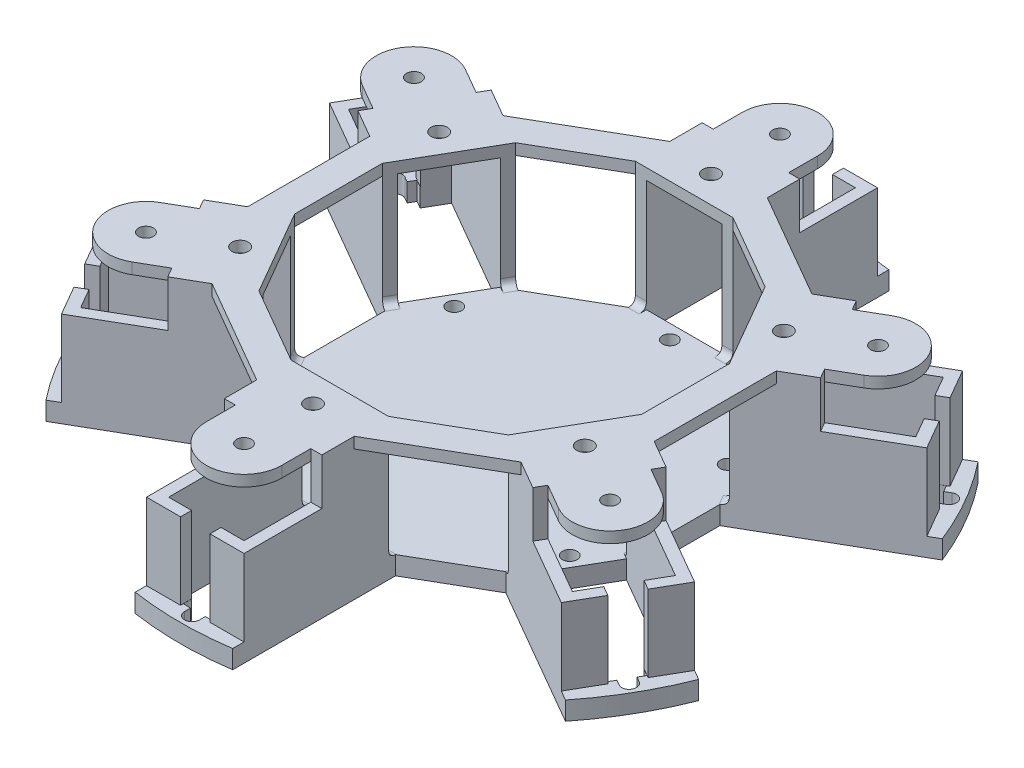
from build123d import *

# Parameters (mm, degrees)
SKETCH1_R           = 57.15
SKETCH1_R_2         = 1.27
BOSS_EXTRUDE2_DEPTH = 3.175
CUT_EXTRUDE1_REACH  = 82.885
BOSS_EXTRUDE3_DEPTH = 13.208
SKETCH4_W           = 5.08
SKETCH4_H           = 13.208
CUT_EXTRUDE2_DEPTH  = 13.208
CIRPATTERN2_COUNT   = 6
FILLET1_SIZE        = 1.27
SKETCH5_W           = 1.905
SKETCH5_H           = 11.5
BOSS_EXTRUDE4_DEPTH = 6.096
BOSS_EXTRUDE5_DEPTH = 1.905
CUT_EXTRUDE3_REACH  = 83.771
SKETCH7_R           = 1.27
CUT_EXTRUDE6_REACH  = 83.771
SKETCH10_R          = 1.397


with BuildPart() as part:
    # Sketch1 → Boss-Extrude2 (new body)
    with BuildSketch(Plane(origin=(0, 0, 0), x_dir=(1, 0, 0), z_dir=(0, 1, 0))):
        with Locations(Location((0, 0, 0), (0, 0, 270))):
            Circle(SKETCH1_R)
        with Locations(Location((0, 27.199984322, 0), (0, 0, 270))):
            Circle(SKETCH1_R_2, mode=Mode.SUBTRACT)
        with Locations(Location((23.555877406, 13.599992161, 0), (0, 0, 270))):
            Circle(SKETCH1_R_2, mode=Mode.SUBTRACT)
        with Locations(Location((23.555877406, -13.599992161, 0), (0, 0, 270))):
            Circle(SKETCH1_R_2, mode=Mode.SUBTRACT)
        with Locations(Location((0, -27.199984322, 0), (0, 0, 270))):
            Circle(SKETCH1_R_2, mode=Mode.SUBTRACT)
        with Locations(Location((-23.555877406, -13.599992161, 0), (0, 0, 270))):
            Circle(SKETCH1_R_2, mode=Mode.SUBTRACT)
        with Locations(Location((-23.555877406, 13.599992161, 0), (0, 0, 270))):
            Circle(SKETCH1_R_2, mode=Mode.SUBTRACT)
        with BuildLine():
            Line((42.36354444, 31.964157286), (22.444960153, 20.464157286))
            Line((22.444960153, 20.464157286), (28.944960153, 9.205827036))
            Line((28.944960153, 9.205827036), (48.86354444, 20.705827036))
            Line((48.86354444, 20.705827036), (46.873897128, 24.151997269))
            Line((46.873897128, 24.151997269), (48.124235564, 24.873880501))
            Line((48.124235564, 24.873880501), (47.498882875, 25.957023131))
            Line((47.498882875, 25.957023131), (48.387627187, 26.470139898))
            ThreePointArc((48.387627187, 26.470139898), (48.85247945, 28.204992161), (47.117627187, 28.669844424))
            Line((47.117627187, 28.669844424), (46.228882875, 28.156727656))
            Line((46.228882875, 28.156727656), (45.603530187, 29.239870285))
            Line((45.603530187, 29.239870285), (44.353191751, 28.517987053))
            Line((44.353191751, 28.517987053), (42.36354444, 31.964157286))
        make_face(mode=Mode.SUBTRACT)
        with BuildLine():
            Line((-6.5, 52.669984322), (-2.520705377, 52.669984322))
            Line((-2.520705377, 52.669984322), (-2.520705377, 54.113750787))
            Line((-2.520705377, 54.113750787), (-1.27, 54.113750787))
            Line((-1.27, 54.113750787), (-1.27, 55.139984322))
            ThreePointArc((-1.27, 55.139984322), (0, 56.409984322), (1.27, 55.139984322))
            Line((1.27, 55.139984322), (1.27, 54.113750787))
            Line((1.27, 54.113750787), (2.520705377, 54.113750787))
            Line((2.520705377, 54.113750787), (2.520705377, 52.669984322))
            Line((2.520705377, 52.669984322), (6.5, 52.669984322))
            Line((6.5, 52.669984322), (6.5, 29.669984322))
            Line((6.5, 29.669984322), (-6.5, 29.669984322))
            Line((-6.5, 29.669984322), (-6.5, 52.669984322))
        make_face(mode=Mode.SUBTRACT)
        with BuildLine():
            Line((48.86354444, -20.705827036), (28.944960153, -9.205827036))
            Line((28.944960153, -9.205827036), (22.444960153, -20.464157286))
            Line((22.444960153, -20.464157286), (42.36354444, -31.964157286))
            Line((42.36354444, -31.964157286), (44.353191751, -28.517987053))
            Line((44.353191751, -28.517987053), (45.603530187, -29.239870285))
            Line((45.603530187, -29.239870285), (46.228882876, -28.156727656))
            Line((46.228882876, -28.156727656), (47.117627187, -28.669844424))
            ThreePointArc((47.117627187, -28.669844424), (48.85247945, -28.204992161), (48.387627187, -26.470139898))
            Line((48.387627187, -26.470139898), (47.498882876, -25.957023131))
            Line((47.498882876, -25.957023131), (48.124235564, -24.873880501))
            Line((48.124235564, -24.873880501), (46.873897128, -24.151997269))
            Line((46.873897128, -24.151997269), (48.86354444, -20.705827036))
        make_face(mode=Mode.SUBTRACT)
        with BuildLine():
            Line((6.5, -52.669984322), (6.5, -29.669984322))
            Line((6.5, -29.669984322), (-6.5, -29.669984322))
            Line((-6.5, -29.669984322), (-6.5, -52.669984322))
            Line((-6.5, -52.669984322), (-2.520705377, -52.669984322))
            Line((-2.520705377, -52.669984322), (-2.520705377, -54.113750787))
            Line((-2.520705377, -54.113750787), (-1.27, -54.113750787))
            Line((-1.27, -54.113750787), (-1.27, -55.139984322))
            ThreePointArc((-1.27, -55.139984322), (0, -56.409984322), (1.27, -55.139984322))
            Line((1.27, -55.139984322), (1.27, -54.113750787))
            Line((1.27, -54.113750787), (2.520705377, -54.113750787))
            Line((2.520705377, -54.113750787), (2.520705377, -52.669984322))
            Line((2.520705377, -52.669984322), (6.5, -52.669984322))
        make_face(mode=Mode.SUBTRACT)
        with BuildLine():
            Line((-42.36354444, -31.964157286), (-22.444960153, -20.464157286))
            Line((-22.444960153, -20.464157286), (-28.944960153, -9.205827036))
            Line((-28.944960153, -9.205827036), (-48.86354444, -20.705827036))
            Line((-48.86354444, -20.705827036), (-46.873897128, -24.151997269))
            Line((-46.873897128, -24.151997269), (-48.124235564, -24.873880501))
            Line((-48.124235564, -24.873880501), (-47.498882875, -25.957023131))
            Line((-47.498882875, -25.957023131), (-48.387627187, -26.470139898))
            ThreePointArc((-48.387627187, -26.470139898), (-48.85247945, -28.204992161), (-47.117627187, -28.669844424))
            Line((-47.117627187, -28.669844424), (-46.228882875, -28.156727656))
            Line((-46.228882875, -28.156727656), (-45.603530187, -29.239870285))
            Line((-45.603530187, -29.239870285), (-44.353191751, -28.517987053))
            Line((-44.353191751, -28.517987053), (-42.36354444, -31.964157286))
        make_face(mode=Mode.SUBTRACT)
        with BuildLine():
            Line((-48.86354444, 20.705827036), (-28.944960153, 9.205827036))
            Line((-28.944960153, 9.205827036), (-22.444960153, 20.464157286))
            Line((-22.444960153, 20.464157286), (-42.36354444, 31.964157286))
            Line((-42.36354444, 31.964157286), (-44.353191751, 28.517987053))
            Line((-44.353191751, 28.517987053), (-45.603530187, 29.239870285))
            Line((-45.603530187, 29.239870285), (-46.228882875, 28.156727656))
            Line((-46.228882875, 28.156727656), (-47.117627187, 28.669844424))
            ThreePointArc((-47.117627187, 28.669844424), (-48.85247945, 28.204992161), (-48.387627187, 26.470139898))
            Line((-48.387627187, 26.470139898), (-47.498882875, 25.957023131))
            Line((-47.498882875, 25.957023131), (-48.124235564, 24.873880501))
            Line((-48.124235564, 24.873880501), (-46.873897128, 24.151997269))
            Line((-46.873897128, 24.151997269), (-48.86354444, 20.705827036))
        make_face(mode=Mode.SUBTRACT)
    extrude(amount=BOSS_EXTRUDE2_DEPTH)

    # Sketch2 → Cut-Extrude1 (cut, up to next)
    with BuildSketch(Plane(origin=(0, 3.175, 0), x_dir=(1, 0, 0), z_dir=(0, 1, 0)), mode=Mode.PRIVATE) as cut_extrude1_sk1:
        with BuildLine():
            Line((-8.405, 28.480431649), (-20.462277319, 21.519159343))
            Line((-20.462277319, 21.519159343), (-44.752671905, 35.543225196))
            ThreePointArc((-44.752671905, 35.543225196), (-28.575, 49.493351826), (-8.405, 56.528563355))
            Line((-8.405, 56.528563355), (-8.405, 28.480431649))
        make_face()
    cut_extrude1_tool1 = extrude(cut_extrude1_sk1.sketch, amount=-CUT_EXTRUDE1_REACH, mode=Mode.PRIVATE) & part.part
    # Sketch2 → Cut-Extrude1 (cut, up to next)
    with BuildSketch(Plane(origin=(0, 3.175, 0), x_dir=(1, 0, 0), z_dir=(0, 1, 0)), mode=Mode.PRIVATE) as cut_extrude1_sk2:
        with BuildLine():
            Line((8.405, 28.480431649), (8.405, 56.528563355))
            ThreePointArc((8.405, 56.528563355), (28.575, 49.493351826), (44.752671905, 35.543225196))
            Line((44.752671905, 35.543225196), (20.462277319, 21.519159344))
            Line((20.462277319, 21.519159344), (8.405, 28.480431649))
        make_face()
    cut_extrude1_tool2 = extrude(cut_extrude1_sk2.sketch, amount=-CUT_EXTRUDE1_REACH, mode=Mode.PRIVATE) & part.part
    # Sketch2 → Cut-Extrude1 (cut, up to next)
    with BuildSketch(Plane(origin=(0, 3.175, 0), x_dir=(1, 0, 0), z_dir=(0, 1, 0)), mode=Mode.PRIVATE) as cut_extrude1_sk3:
        with BuildLine():
            Line((28.867277319, 6.961272306), (53.157671905, 20.985338159))
            ThreePointArc((53.157671905, 20.985338159), (57.15, 0), (53.157671905, -20.985338159))
            Line((53.157671905, -20.985338159), (28.867277319, -6.961272306))
            Line((28.867277319, -6.961272306), (28.867277319, 6.961272306))
        make_face()
    cut_extrude1_tool3 = extrude(cut_extrude1_sk3.sketch, amount=-CUT_EXTRUDE1_REACH, mode=Mode.PRIVATE) & part.part
    # Sketch2 → Cut-Extrude1 (cut, up to next)
    with BuildSketch(Plane(origin=(0, 3.175, 0), x_dir=(1, 0, 0), z_dir=(0, 1, 0)), mode=Mode.PRIVATE) as cut_extrude1_sk4:
        with BuildLine():
            Line((20.462277319, -21.519159343), (44.752671905, -35.543225196))
            ThreePointArc((44.752671905, -35.543225196), (28.575, -49.493351826), (8.405, -56.528563355))
            Line((8.405, -56.528563355), (8.405, -28.480431649))
            Line((8.405, -28.480431649), (20.462277319, -21.519159343))
        make_face()
    cut_extrude1_tool4 = extrude(cut_extrude1_sk4.sketch, amount=-CUT_EXTRUDE1_REACH, mode=Mode.PRIVATE) & part.part
    # Sketch2 → Cut-Extrude1 (cut, up to next)
    with BuildSketch(Plane(origin=(0, 3.175, 0), x_dir=(1, 0, 0), z_dir=(0, 1, 0)), mode=Mode.PRIVATE) as cut_extrude1_sk5:
        with BuildLine():
            Line((-8.405, -28.480431649), (-8.405, -56.528563355))
            ThreePointArc((-8.405, -56.528563355), (-28.575, -49.493351826), (-44.752671905, -35.543225196))
            Line((-44.752671905, -35.543225196), (-20.462277319, -21.519159344))
            Line((-20.462277319, -21.519159344), (-8.405, -28.480431649))
        make_face()
    cut_extrude1_tool5 = extrude(cut_extrude1_sk5.sketch, amount=-CUT_EXTRUDE1_REACH, mode=Mode.PRIVATE) & part.part
    # Sketch2 → Cut-Extrude1 (cut, up to next)
    with BuildSketch(Plane(origin=(0, 3.175, 0), x_dir=(1, 0, 0), z_dir=(0, 1, 0)), mode=Mode.PRIVATE) as cut_extrude1_sk6:
        with BuildLine():
            Line((-28.867277319, -6.961272306), (-53.157671905, -20.985338159))
            ThreePointArc((-53.157671905, -20.985338159), (-57.15, 0), (-53.157671905, 20.985338159))
            Line((-53.157671905, 20.985338159), (-28.867277319, 6.961272306))
            Line((-28.867277319, 6.961272306), (-28.867277319, -6.961272306))
        make_face()
    cut_extrude1_tool6 = extrude(cut_extrude1_sk6.sketch, amount=-CUT_EXTRUDE1_REACH, mode=Mode.PRIVATE) & part.part
    add(cut_extrude1_tool1.solids().sort_by_distance((-22.354851, 3.175, -38.719738))[0], mode=Mode.SUBTRACT)
    add(cut_extrude1_tool2.solids().sort_by_distance((22.354851, 3.175, -38.719738))[0], mode=Mode.SUBTRACT)
    add(cut_extrude1_tool3.solids().sort_by_distance((44.709702, 3.175, 0))[0], mode=Mode.SUBTRACT)
    add(cut_extrude1_tool4.solids().sort_by_distance((22.354851, 3.175, 38.719738))[0], mode=Mode.SUBTRACT)
    add(cut_extrude1_tool5.solids().sort_by_distance((-22.354851, 3.175, 38.719738))[0], mode=Mode.SUBTRACT)
    add(cut_extrude1_tool6.solids().sort_by_distance((-44.709702, 3.175, 0))[0], mode=Mode.SUBTRACT)

    # Sketch3 → Boss-Extrude3 (add)
    with BuildSketch(Plane(origin=(0, 3.175, 0), x_dir=(1, 0, 0), z_dir=(0, 1, 0))):
        Polygon((42.36354444, 31.964157286), (22.444960153, 20.464157286), (21.492460153, 22.11393568), (41.41104444, 33.61393568), (43.060822834, 34.56643568), (51.465822834, 20.008548642), (49.81604444, 19.056048642), (29.897460153, 7.556048642), (28.944960153, 9.205827036), (48.86354444, 20.705827036), align=None)
        Polygon((-6.5, 52.669984322), (-6.5, 29.669984322), (-8.405, 29.669984322), (-8.405, 52.669984322), (-8.405, 54.574984322), (8.405, 54.574984322), (8.405, 52.669984322), (8.405, 29.669984322), (6.5, 29.669984322), (6.5, 52.669984322), align=None)
        Polygon((48.86354444, -20.705827036), (28.944960153, -9.205827036), (29.897460153, -7.556048642), (49.81604444, -19.056048642), (51.465822834, -20.008548642), (43.060822834, -34.56643568), (41.41104444, -33.61393568), (21.492460153, -22.11393568), (22.444960153, -20.464157286), (42.36354444, -31.964157286), align=None)
        Polygon((6.5, -52.669984322), (6.5, -29.669984322), (8.405, -29.669984322), (8.405, -52.669984322), (8.405, -54.574984322), (-8.405, -54.574984322), (-8.405, -52.669984322), (-8.405, -29.669984322), (-6.5, -29.669984322), (-6.5, -52.669984322), align=None)
        Polygon((-42.36354444, -31.964157286), (-22.444960153, -20.464157286), (-21.492460153, -22.11393568), (-41.41104444, -33.61393568), (-43.060822834, -34.56643568), (-51.465822834, -20.008548642), (-49.81604444, -19.056048642), (-29.897460153, -7.556048642), (-28.944960153, -9.205827036), (-48.86354444, -20.705827036), align=None)
        Polygon((-48.86354444, 20.705827036), (-28.944960153, 9.205827036), (-29.897460153, 7.556048642), (-49.81604444, 19.056048642), (-51.465822834, 20.008548642), (-43.060822834, 34.56643568), (-41.41104444, 33.61393568), (-21.492460153, 22.11393568), (-22.444960153, 20.464157286), (-42.36354444, 31.964157286), align=None)
    extrude(amount=BOSS_EXTRUDE3_DEPTH)

    # Sketch4 → Cut-Extrude2 (cut)
    with BuildSketch(Plane(origin=(0, 0, -54.574984322), x_dir=(-1, 0, 0), z_dir=(0, 0, -1))):
        with Locations((0, 9.779)):
            Rectangle(SKETCH4_W, SKETCH4_H)
    cut_extrude2 = extrude(amount=-CUT_EXTRUDE2_DEPTH, mode=Mode.SUBTRACT)

    # CirPattern2: Cut-Extrude2 ×6 about axis
    cirpattern2_axis = Axis((0, 0, 0), (0, 1, 0))
    for i in range(1, CIRPATTERN2_COUNT):
        add(cut_extrude2.rotate(cirpattern2_axis, i * 360 / CIRPATTERN2_COUNT), mode=Mode.SUBTRACT)

    # Fillet1
    # a fillet whose section is not a circle: 1.27 mm, written as the material it adds along each edge
    with BuildSketch(Plane(origin=(22.444960153, 3.175, -20.464157286), x_dir=(-0.8660254037844386, 0, 0.5000000000000001), z_dir=(-0.5000000000000001, 0, -0.8660254037844387))) as fillet1_piece_1_section:
        with BuildLine():
            Bezier((FILLET1_SIZE, 0), (0, 0), (0, FILLET1_SIZE), weights=[1, 1, 1])
            Line((0, FILLET1_SIZE), (0, 0))
            Line((0, 0), (FILLET1_SIZE, 0))
        make_face()
    fillet1_piece_1 = extrude(amount=5.08, mode=Mode.PRIVATE)
    fillet1_piece_1 = split(fillet1_piece_1, bisect_by=Plane(origin=(22.406118736, 3.175, -20.396881978), z_dir=(-0.4999999999995493, 0, 0.8660254037846988)), keep=Keep.TOP, mode=Mode.PRIVATE)
    add(fillet1_piece_1)
    with BuildSketch(Plane(origin=(22.444960153, 3.175, -20.464157286), x_dir=(-0.8660254037844386, 0, 0.5000000000000001), z_dir=(-0.5000000000000001, 0, -0.8660254037844387)), Plane(origin=(29.897460153, 3.175, -7.556048642), x_dir=(-0.866025403784437, 0, 0.5000000000000027), z_dir=(-0.5000000000000028, 0, -0.8660254037844372)), Plane(origin=(28.944960153, 3.175, 9.205827036), x_dir=(-0.8660254037844377, 0, -0.5000000000000017), z_dir=(0.5000000000000017, 0, -0.8660254037844377)), Plane(origin=(21.492460153, 3.175, 22.11393568), x_dir=(-0.8660254037844394, 0, -0.49999999999999867), z_dir=(0.4999999999999987, 0, -0.8660254037844395)), Plane(origin=(-22.444960153, 3.175, 20.464157286), x_dir=(0.8660254037844394, 0, -0.49999999999999867), z_dir=(0.4999999999999987, 0, 0.8660254037844395)), Plane(origin=(-29.897460153, 3.175, 7.556048642), x_dir=(0.8660254037844372, 0, -0.5000000000000024), z_dir=(0.5000000000000026, 0, 0.8660254037844373)), Plane(origin=(-28.944960153, 3.175, -9.205827036), x_dir=(0.8660254037844395, 0, 0.49999999999999845), z_dir=(-0.4999999999999985, 0, 0.8660254037844395)), Plane(origin=(-21.492460153, 3.175, -22.11393568), x_dir=(0.8660254037844394, 0, 0.49999999999999867), z_dir=(-0.4999999999999987, 0, 0.8660254037844395)), Plane(origin=(-6.5, 3.175, -29.669984322), x_dir=(0, 0, 1), z_dir=(-1, 0, 0)), Plane(origin=(8.405, 3.175, -29.669984322), x_dir=(0, 0, 1), z_dir=(-1, 0, 0))) as fillet1_piece_2:
        with BuildLine():
            Bezier((FILLET1_SIZE, 0), (0, 0), (0, FILLET1_SIZE), weights=[1, 1, 1])
            Line((0, FILLET1_SIZE), (0, 0))
            Line((0, 0), (FILLET1_SIZE, 0))
        make_face()
    extrude(amount=1.905)
    with BuildSketch(Plane(origin=(31.484960153, 3.175, -4.806417985), x_dir=(-0.866025403784437, 0, 0.5000000000000027), z_dir=(-0.5000000000000028, 0, -0.8660254037844372))) as fillet1_piece_3_section:
        with BuildLine():
            Bezier((FILLET1_SIZE, 0), (0, 0), (0, FILLET1_SIZE), weights=[1, 1, 1])
            Line((0, FILLET1_SIZE), (0, 0))
            Line((0, 0), (FILLET1_SIZE, 0))
        make_face()
    fillet1_piece_3 = extrude(amount=5.08, mode=Mode.PRIVATE)
    fillet1_piece_3 = split(fillet1_piece_3, bisect_by=Plane(origin=(28.867277319, 3.175, -4.806417985), z_dir=(-1, 0, 0)), keep=Keep.TOP, mode=Mode.PRIVATE)
    add(fillet1_piece_3)
    with BuildSketch(Plane(origin=(28.944960153, 3.175, 9.205827036), x_dir=(-0.8660254037844377, 0, -0.5000000000000017), z_dir=(0.5000000000000017, 0, -0.8660254037844377))) as fillet1_piece_4_section:
        with BuildLine():
            Bezier((FILLET1_SIZE, 0), (0, 0), (0, FILLET1_SIZE), weights=[1, 1, 1])
            Line((0, FILLET1_SIZE), (0, 0))
            Line((0, 0), (FILLET1_SIZE, 0))
        make_face()
    fillet1_piece_4 = extrude(amount=5.08, mode=Mode.PRIVATE)
    fillet1_piece_4 = split(fillet1_piece_4, bisect_by=Plane(origin=(28.867277319, 3.175, 9.205827036), z_dir=(-1, 0, 0)), keep=Keep.TOP, mode=Mode.PRIVATE)
    add(fillet1_piece_4)
    with BuildSketch(Plane(origin=(19.904960153, 3.175, 24.863566337), x_dir=(-0.8660254037844394, 0, -0.49999999999999867), z_dir=(0.4999999999999987, 0, -0.8660254037844395))) as fillet1_piece_5_section:
        with BuildLine():
            Bezier((FILLET1_SIZE, 0), (0, 0), (0, FILLET1_SIZE), weights=[1, 1, 1])
            Line((0, FILLET1_SIZE), (0, 0))
            Line((0, 0), (FILLET1_SIZE, 0))
        make_face()
    fillet1_piece_5 = extrude(amount=5.08, mode=Mode.PRIVATE)
    fillet1_piece_5 = split(fillet1_piece_5, bisect_by=Plane(origin=(18.596118736, 3.175, 22.596586504), z_dir=(-0.5000000000004493, 0, -0.8660254037841792)), keep=Keep.TOP, mode=Mode.PRIVATE)
    add(fillet1_piece_5)
    with BuildSketch(Plane(origin=(6.5, 3.175, 29.669984322), x_dir=(0, 1, 0), z_dir=(1, 0, 0))) as fillet1_piece_6_section:
        with BuildLine():
            Bezier((FILLET1_SIZE, 0), (0, 0), (0, -FILLET1_SIZE), weights=[1, 1, 1])
            Line((0, -FILLET1_SIZE), (0, 0))
            Line((0, 0), (FILLET1_SIZE, 0))
        make_face()
    fillet1_piece_6 = extrude(amount=5.08, mode=Mode.PRIVATE)
    fillet1_piece_6 = split(fillet1_piece_6, bisect_by=Plane(origin=(6.461158583, 3.175, 29.602709015), z_dir=(-0.5000000000004493, 0, -0.8660254037841792)), keep=Keep.TOP, mode=Mode.PRIVATE)
    add(fillet1_piece_6)
    with BuildSketch(Plane(origin=(6.5, 3.175, 29.669984322), x_dir=(0, 1, 0), z_dir=(1, 0, 0)), Plane(origin=(-8.405, 3.175, 29.669984322), x_dir=(0, 1, 0), z_dir=(1, 0, 0))) as fillet1_piece_7:
        with BuildLine():
            Bezier((FILLET1_SIZE, 0), (0, 0), (0, -FILLET1_SIZE), weights=[1, 1, 1])
            Line((0, -FILLET1_SIZE), (0, 0))
            Line((0, 0), (FILLET1_SIZE, 0))
        make_face()
    extrude(amount=1.905)
    with BuildSketch(Plane(origin=(-11.58, 3.175, 29.669984322), x_dir=(0, 1, 0), z_dir=(1, 0, 0))) as fillet1_piece_8_section:
        with BuildLine():
            Bezier((FILLET1_SIZE, 0), (0, 0), (0, -FILLET1_SIZE), weights=[1, 1, 1])
            Line((0, -FILLET1_SIZE), (0, 0))
            Line((0, 0), (FILLET1_SIZE, 0))
        make_face()
    fillet1_piece_8 = extrude(amount=5.08, mode=Mode.PRIVATE)
    fillet1_piece_8 = split(fillet1_piece_8, bisect_by=Plane(origin=(-10.271158583, 3.175, 27.403004489), z_dir=(0.4999999999995525, 0, -0.866025403784697)), keep=Keep.TOP, mode=Mode.PRIVATE)
    add(fillet1_piece_8)
    with BuildSketch(Plane(origin=(-22.444960153, 3.175, 20.464157286), x_dir=(0.8660254037844394, 0, -0.49999999999999867), z_dir=(0.4999999999999987, 0, 0.8660254037844395))) as fillet1_piece_9_section:
        with BuildLine():
            Bezier((FILLET1_SIZE, 0), (0, 0), (0, FILLET1_SIZE), weights=[1, 1, 1])
            Line((0, FILLET1_SIZE), (0, 0))
            Line((0, 0), (FILLET1_SIZE, 0))
        make_face()
    fillet1_piece_9 = extrude(amount=5.08, mode=Mode.PRIVATE)
    fillet1_piece_9 = split(fillet1_piece_9, bisect_by=Plane(origin=(-22.406118736, 3.175, 20.396881978), z_dir=(0.4999999999995525, 0, -0.866025403784697)), keep=Keep.TOP, mode=Mode.PRIVATE)
    add(fillet1_piece_9)
    with BuildSketch(Plane(origin=(-31.484960153, 3.175, 4.806417985), x_dir=(0.8660254037844372, 0, -0.5000000000000024), z_dir=(0.5000000000000026, 0, 0.8660254037844373))) as fillet1_piece_10_section:
        with BuildLine():
            Bezier((FILLET1_SIZE, 0), (0, 0), (0, FILLET1_SIZE), weights=[1, 1, 1])
            Line((0, FILLET1_SIZE), (0, 0))
            Line((0, 0), (FILLET1_SIZE, 0))
        make_face()
    fillet1_piece_10 = extrude(amount=5.08, mode=Mode.PRIVATE)
    fillet1_piece_10 = split(fillet1_piece_10, bisect_by=Plane(origin=(-28.867277319, 3.175, 4.806417985), z_dir=(1, 0, 0)), keep=Keep.TOP, mode=Mode.PRIVATE)
    add(fillet1_piece_10)
    with BuildSketch(Plane(origin=(-28.944960153, 3.175, -9.205827036), x_dir=(0.8660254037844395, 0, 0.49999999999999845), z_dir=(-0.4999999999999985, 0, 0.8660254037844395))) as fillet1_piece_11_section:
        with BuildLine():
            Bezier((FILLET1_SIZE, 0), (0, 0), (0, FILLET1_SIZE), weights=[1, 1, 1])
            Line((0, FILLET1_SIZE), (0, 0))
            Line((0, 0), (FILLET1_SIZE, 0))
        make_face()
    fillet1_piece_11 = extrude(amount=5.08, mode=Mode.PRIVATE)
    fillet1_piece_11 = split(fillet1_piece_11, bisect_by=Plane(origin=(-28.867277319, 3.175, -9.205827036), z_dir=(1, 0, 0)), keep=Keep.TOP, mode=Mode.PRIVATE)
    add(fillet1_piece_11)
    with BuildSketch(Plane(origin=(-19.904960153, 3.175, -24.863566337), x_dir=(0.8660254037844394, 0, 0.49999999999999867), z_dir=(-0.4999999999999987, 0, 0.8660254037844395))) as fillet1_piece_12_section:
        with BuildLine():
            Bezier((FILLET1_SIZE, 0), (0, 0), (0, FILLET1_SIZE), weights=[1, 1, 1])
            Line((0, FILLET1_SIZE), (0, 0))
            Line((0, 0), (FILLET1_SIZE, 0))
        make_face()
    fillet1_piece_12 = extrude(amount=5.08, mode=Mode.PRIVATE)
    fillet1_piece_12 = split(fillet1_piece_12, bisect_by=Plane(origin=(-18.596118736, 3.175, -22.596586504), z_dir=(0.5000000000004517, 0, 0.8660254037841778)), keep=Keep.TOP, mode=Mode.PRIVATE)
    add(fillet1_piece_12)
    with BuildSketch(Plane(origin=(-6.5, 3.175, -29.669984322), x_dir=(0, 0, 1), z_dir=(-1, 0, 0))) as fillet1_piece_13_section:
        with BuildLine():
            Bezier((FILLET1_SIZE, 0), (0, 0), (0, FILLET1_SIZE), weights=[1, 1, 1])
            Line((0, FILLET1_SIZE), (0, 0))
            Line((0, 0), (FILLET1_SIZE, 0))
        make_face()
    fillet1_piece_13 = extrude(amount=5.08, mode=Mode.PRIVATE)
    fillet1_piece_13 = split(fillet1_piece_13, bisect_by=Plane(origin=(-6.461158583, 3.175, -29.602709015), z_dir=(0.5000000000004517, 0, 0.8660254037841778)), keep=Keep.TOP, mode=Mode.PRIVATE)
    add(fillet1_piece_13)
    with BuildSketch(Plane(origin=(11.58, 3.175, -29.669984322), x_dir=(0, 0, 1), z_dir=(-1, 0, 0))) as fillet1_piece_14_section:
        with BuildLine():
            Bezier((FILLET1_SIZE, 0), (0, 0), (0, FILLET1_SIZE), weights=[1, 1, 1])
            Line((0, FILLET1_SIZE), (0, 0))
            Line((0, 0), (FILLET1_SIZE, 0))
        make_face()
    fillet1_piece_14 = extrude(amount=5.08, mode=Mode.PRIVATE)
    fillet1_piece_14 = split(fillet1_piece_14, bisect_by=Plane(origin=(10.271158583, 3.175, -27.403004489), z_dir=(-0.4999999999995493, 0, 0.8660254037846988)), keep=Keep.TOP, mode=Mode.PRIVATE)
    add(fillet1_piece_14)

    # Sketch5 → Boss-Extrude4 (add)
    with BuildSketch(Plane(origin=(0, 16.383, 0), x_dir=(1, 0, 0), z_dir=(0, 1, 0))):
        with Locations((-7.4525, 35.419984322)):
            Rectangle(SKETCH5_W, SKETCH5_H)
        with Locations((7.4525, 35.419984322)):
            Rectangle(SKETCH5_W, SKETCH5_H)
        Polygon((32.404252296, 26.214157286), (22.444960153, 20.464157286), (21.492460153, 22.11393568), (31.451752296, 27.86393568), align=None)
        Polygon((28.944960153, 9.205827036), (29.897460153, 7.556048642), (39.856752296, 13.306048642), (38.904252296, 14.955827036), align=None)
        Polygon((38.904252296, -14.955827036), (28.944960153, -9.205827036), (29.897460153, -7.556048642), (39.856752296, -13.306048642), align=None)
        Polygon((22.444960153, -20.464157286), (21.492460153, -22.11393568), (31.451752296, -27.86393568), (32.404252296, -26.214157286), align=None)
        with Locations((7.4525, -35.419984322)):
            Rectangle(SKETCH5_W, SKETCH5_H)
        with Locations((-7.4525, -35.419984322)):
            Rectangle(SKETCH5_W, SKETCH5_H)
        Polygon((-32.404252296, -26.214157286), (-22.444960153, -20.464157286), (-21.492460153, -22.11393568), (-31.451752296, -27.86393568), align=None)
        Polygon((-28.944960153, -9.205827036), (-29.897460153, -7.556048642), (-39.856752296, -13.306048642), (-38.904252296, -14.955827036), align=None)
        Polygon((-38.904252296, 14.955827036), (-28.944960153, 9.205827036), (-29.897460153, 7.556048642), (-39.856752296, 13.306048642), align=None)
        Polygon((-22.444960153, 20.464157286), (-21.492460153, 22.11393568), (-31.451752296, 27.86393568), (-32.404252296, 26.214157286), align=None)
    extrude(amount=BOSS_EXTRUDE4_DEPTH)

    # Sketch6 → Boss-Extrude5 (add)
    with BuildSketch(Plane(origin=(0, 22.479, 0), x_dir=(1, 0, 0), z_dir=(0, 1, 0))):
        with BuildLine():
            Line((-6.5, 46.169984322), (-6.5, 41.169984322))
            Line((-6.5, 41.169984322), (-8.405, 41.169984322))
            Line((-8.405, 41.169984322), (-8.405, 35.587821469))
            Line((-8.405, 35.587821469), (-26.617457457, 25.072854253))
            Line((-26.617457457, 25.072854253), (-31.451752296, 27.86393568))
            Line((-31.451752296, 27.86393568), (-32.404252296, 26.214157286))
            Line((-32.404252296, 26.214157286), (-36.734379315, 28.714157286))
            ThreePointArc((-36.734379315, 28.714157286), (-45.61354444, 26.334992161), (-43.234379315, 17.455827036))
            Line((-43.234379315, 17.455827036), (-38.904252296, 14.955827036))
            Line((-38.904252296, 14.955827036), (-39.856752296, 13.306048642))
            Line((-39.856752296, 13.306048642), (-35.022457457, 10.514967216))
            Line((-35.022457457, 10.514967216), (-35.022457457, -10.514967216))
            Line((-35.022457457, -10.514967216), (-39.856752296, -13.306048642))
            Line((-39.856752296, -13.306048642), (-38.904252296, -14.955827036))
            Line((-38.904252296, -14.955827036), (-43.234379315, -17.455827036))
            ThreePointArc((-43.234379315, -17.455827036), (-45.61354444, -26.334992161), (-36.734379315, -28.714157286))
            Line((-36.734379315, -28.714157286), (-32.404252296, -26.214157286))
            Line((-32.404252296, -26.214157286), (-31.451752296, -27.86393568))
            Line((-31.451752296, -27.86393568), (-26.617457457, -25.072854253))
            Line((-26.617457457, -25.072854253), (-8.405, -35.587821469))
            Line((-8.405, -35.587821469), (-8.405, -41.169984322))
            Line((-8.405, -41.169984322), (-6.5, -41.169984322))
            Line((-6.5, -41.169984322), (-6.5, -46.169984322))
            ThreePointArc((-6.5, -46.169984322), (0, -52.669984322), (6.5, -46.169984322))
            Line((6.5, -46.169984322), (6.5, -41.169984322))
            Line((6.5, -41.169984322), (8.405, -41.169984322))
            Line((8.405, -41.169984322), (8.405, -35.587821469))
            Line((8.405, -35.587821469), (26.617457457, -25.072854253))
            Line((26.617457457, -25.072854253), (31.451752296, -27.86393568))
            Line((31.451752296, -27.86393568), (32.404252296, -26.214157286))
            Line((32.404252296, -26.214157286), (36.734379315, -28.714157286))
            ThreePointArc((36.734379315, -28.714157286), (45.61354444, -26.334992161), (43.234379315, -17.455827036))
            Line((43.234379315, -17.455827036), (38.904252296, -14.955827036))
            Line((38.904252296, -14.955827036), (39.856752296, -13.306048642))
            Line((39.856752296, -13.306048642), (35.022457457, -10.514967216))
            Line((35.022457457, -10.514967216), (35.022457457, 10.514967216))
            Line((35.022457457, 10.514967216), (39.856752296, 13.306048642))
            Line((39.856752296, 13.306048642), (38.904252296, 14.955827036))
            Line((38.904252296, 14.955827036), (43.234379315, 17.455827036))
            ThreePointArc((43.234379315, 17.455827036), (45.61354444, 26.334992161), (36.734379315, 28.714157286))
            Line((36.734379315, 28.714157286), (32.404252296, 26.214157286))
            Line((32.404252296, 26.214157286), (31.451752296, 27.86393568))
            Line((31.451752296, 27.86393568), (26.617457457, 25.072854253))
            Line((26.617457457, 25.072854253), (8.405, 35.587821469))
            Line((8.405, 35.587821469), (8.405, 41.169984322))
            Line((8.405, 41.169984322), (6.5, 41.169984322))
            Line((6.5, 41.169984322), (6.5, 46.169984322))
            ThreePointArc((6.5, 46.169984322), (0, 52.669984322), (-6.5, 46.169984322))
        make_face()
        Polygon((-8.405, 29.669984322), (8.405, 29.669984322), (21.492460153, 22.11393568), (29.897460153, 7.556048642), (29.897460153, -7.556048642), (21.492460153, -22.11393568), (8.405, -29.669984322), (-8.405, -29.669984322), (-21.492460153, -22.11393568), (-29.897460153, -7.556048642), (-29.897460153, 7.556048642), (-21.492460153, 22.11393568), align=None, mode=Mode.SUBTRACT)
    extrude(amount=BOSS_EXTRUDE5_DEPTH)

    # Sketch7 → Cut-Extrude3 (cut, up to next)
    with BuildSketch(Plane(origin=(0, 24.384, 0), x_dir=(1, 0, 0), z_dir=(0, 1, 0)), mode=Mode.PRIVATE) as cut_extrude3_sk1:
        with Locations(Location((0, 46.169984322, 0), (0, 0, 270))):
            Circle(SKETCH7_R)
    cut_extrude3_tool1 = extrude(cut_extrude3_sk1.sketch, amount=-CUT_EXTRUDE3_REACH, mode=Mode.PRIVATE) & part.part
    # Sketch7 → Cut-Extrude3 (cut, up to next)
    with BuildSketch(Plane(origin=(0, 24.384, 0), x_dir=(1, 0, 0), z_dir=(0, 1, 0)), mode=Mode.PRIVATE) as cut_extrude3_sk2:
        with Locations(Location((39.984379315, 23.084992161, 0), (0, 0, 270))):
            Circle(SKETCH7_R)
    cut_extrude3_tool2 = extrude(cut_extrude3_sk2.sketch, amount=-CUT_EXTRUDE3_REACH, mode=Mode.PRIVATE) & part.part
    # Sketch7 → Cut-Extrude3 (cut, up to next)
    with BuildSketch(Plane(origin=(0, 24.384, 0), x_dir=(1, 0, 0), z_dir=(0, 1, 0)), mode=Mode.PRIVATE) as cut_extrude3_sk3:
        with Locations(Location((39.984379315, -23.084992161, 0), (0, 0, 270))):
            Circle(SKETCH7_R)
    cut_extrude3_tool3 = extrude(cut_extrude3_sk3.sketch, amount=-CUT_EXTRUDE3_REACH, mode=Mode.PRIVATE) & part.part
    # Sketch7 → Cut-Extrude3 (cut, up to next)
    with BuildSketch(Plane(origin=(0, 24.384, 0), x_dir=(1, 0, 0), z_dir=(0, 1, 0)), mode=Mode.PRIVATE) as cut_extrude3_sk4:
        with Locations(Location((0, -46.169984322, 0), (0, 0, 270))):
            Circle(SKETCH7_R)
    cut_extrude3_tool4 = extrude(cut_extrude3_sk4.sketch, amount=-CUT_EXTRUDE3_REACH, mode=Mode.PRIVATE) & part.part
    # Sketch7 → Cut-Extrude3 (cut, up to next)
    with BuildSketch(Plane(origin=(0, 24.384, 0), x_dir=(1, 0, 0), z_dir=(0, 1, 0)), mode=Mode.PRIVATE) as cut_extrude3_sk5:
        with Locations(Location((-39.984379315, -23.084992161, 0), (0, 0, 270))):
            Circle(SKETCH7_R)
    cut_extrude3_tool5 = extrude(cut_extrude3_sk5.sketch, amount=-CUT_EXTRUDE3_REACH, mode=Mode.PRIVATE) & part.part
    # Sketch7 → Cut-Extrude3 (cut, up to next)
    with BuildSketch(Plane(origin=(0, 24.384, 0), x_dir=(1, 0, 0), z_dir=(0, 1, 0)), mode=Mode.PRIVATE) as cut_extrude3_sk6:
        with Locations(Location((-39.984379315, 23.084992161, 0), (0, 0, 270))):
            Circle(SKETCH7_R)
    cut_extrude3_tool6 = extrude(cut_extrude3_sk6.sketch, amount=-CUT_EXTRUDE3_REACH, mode=Mode.PRIVATE) & part.part
    add(cut_extrude3_tool1.solids().sort_by_distance((0, 24.384, -46.169984))[0], mode=Mode.SUBTRACT)
    add(cut_extrude3_tool2.solids().sort_by_distance((39.984379, 24.384, -23.084992))[0], mode=Mode.SUBTRACT)
    add(cut_extrude3_tool3.solids().sort_by_distance((39.984379, 24.384, 23.084992))[0], mode=Mode.SUBTRACT)
    add(cut_extrude3_tool4.solids().sort_by_distance((0, 24.384, 46.169984))[0], mode=Mode.SUBTRACT)
    add(cut_extrude3_tool5.solids().sort_by_distance((-39.984379, 24.384, 23.084992))[0], mode=Mode.SUBTRACT)
    add(cut_extrude3_tool6.solids().sort_by_distance((-39.984379, 24.384, -23.084992))[0], mode=Mode.SUBTRACT)

    # Sketch10 → Cut-Extrude6 (cut, up to next)
    with BuildSketch(Plane(origin=(0, 24.384, 0), x_dir=(1, 0, 0), z_dir=(0, 1, 0)), mode=Mode.PRIVATE) as cut_extrude6_sk1:
        with Locations(Location((0, 34.29, 0), (0, 0, 270))):
            Circle(SKETCH10_R)
    cut_extrude6_tool1 = extrude(cut_extrude6_sk1.sketch, amount=-CUT_EXTRUDE6_REACH, mode=Mode.PRIVATE) & part.part
    # Sketch10 → Cut-Extrude6 (cut, up to next)
    with BuildSketch(Plane(origin=(0, 24.384, 0), x_dir=(1, 0, 0), z_dir=(0, 1, 0)), mode=Mode.PRIVATE) as cut_extrude6_sk2:
        with Locations(Location((29.696011096, 17.145, 0), (0, 0, 270))):
            Circle(SKETCH10_R)
    cut_extrude6_tool2 = extrude(cut_extrude6_sk2.sketch, amount=-CUT_EXTRUDE6_REACH, mode=Mode.PRIVATE) & part.part
    # Sketch10 → Cut-Extrude6 (cut, up to next)
    with BuildSketch(Plane(origin=(0, 24.384, 0), x_dir=(1, 0, 0), z_dir=(0, 1, 0)), mode=Mode.PRIVATE) as cut_extrude6_sk3:
        with Locations(Location((29.696011096, -17.145, 0), (0, 0, 270))):
            Circle(SKETCH10_R)
    cut_extrude6_tool3 = extrude(cut_extrude6_sk3.sketch, amount=-CUT_EXTRUDE6_REACH, mode=Mode.PRIVATE) & part.part
    # Sketch10 → Cut-Extrude6 (cut, up to next)
    with BuildSketch(Plane(origin=(0, 24.384, 0), x_dir=(1, 0, 0), z_dir=(0, 1, 0)), mode=Mode.PRIVATE) as cut_extrude6_sk4:
        with Locations(Location((0, -34.29, 0), (0, 0, 270))):
            Circle(SKETCH10_R)
    cut_extrude6_tool4 = extrude(cut_extrude6_sk4.sketch, amount=-CUT_EXTRUDE6_REACH, mode=Mode.PRIVATE) & part.part
    # Sketch10 → Cut-Extrude6 (cut, up to next)
    with BuildSketch(Plane(origin=(0, 24.384, 0), x_dir=(1, 0, 0), z_dir=(0, 1, 0)), mode=Mode.PRIVATE) as cut_extrude6_sk5:
        with Locations(Location((-29.696011096, -17.145, 0), (0, 0, 270))):
            Circle(SKETCH10_R)
    cut_extrude6_tool5 = extrude(cut_extrude6_sk5.sketch, amount=-CUT_EXTRUDE6_REACH, mode=Mode.PRIVATE) & part.part
    # Sketch10 → Cut-Extrude6 (cut, up to next)
    with BuildSketch(Plane(origin=(0, 24.384, 0), x_dir=(1, 0, 0), z_dir=(0, 1, 0)), mode=Mode.PRIVATE) as cut_extrude6_sk6:
        with Locations(Location((-29.696011096, 17.145, 0), (0, 0, 270))):
            Circle(SKETCH10_R)
    cut_extrude6_tool6 = extrude(cut_extrude6_sk6.sketch, amount=-CUT_EXTRUDE6_REACH, mode=Mode.PRIVATE) & part.part
    add(cut_extrude6_tool1.solids().sort_by_distance((0, 24.384, -34.29))[0], mode=Mode.SUBTRACT)
    add(cut_extrude6_tool2.solids().sort_by_distance((29.696011, 24.384, -17.145))[0], mode=Mode.SUBTRACT)
    add(cut_extrude6_tool3.solids().sort_by_distance((29.696011, 24.384, 17.145))[0], mode=Mode.SUBTRACT)
    add(cut_extrude6_tool4.solids().sort_by_distance((0, 24.384, 34.29))[0], mode=Mode.SUBTRACT)
    add(cut_extrude6_tool5.solids().sort_by_distance((-29.696011, 24.384, 17.145))[0], mode=Mode.SUBTRACT)
    add(cut_extrude6_tool6.solids().sort_by_distance((-29.696011, 24.384, -17.145))[0], mode=Mode.SUBTRACT)


solid = part.part
